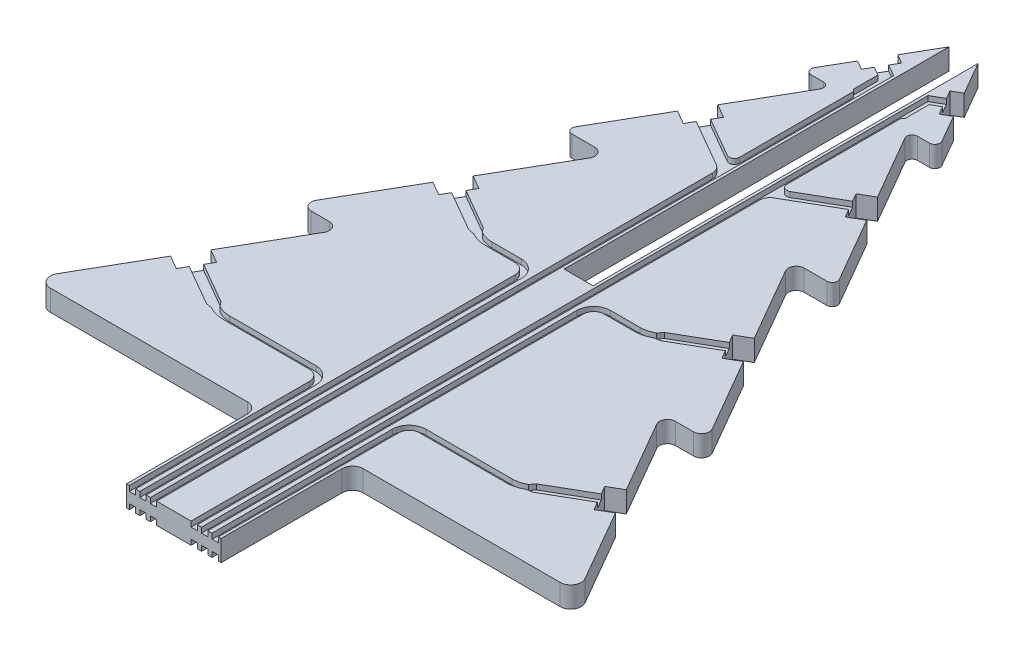
from build123d import *

# Parameters (mm, degrees)
ESBO_O1_W                       = 18
ESBO_O1_H                       = 25
RVORE_DEPTH                     = 4
FILETE2_R                       = 1
FILETE3_R                       = 1
FILETE4_R                       = 1
FILETE5_R                       = 1
FILETE6_R                       = 1
FILETE7_R                       = 1
FILETE8_R                       = 1.5
FILETE9_R                       = 1.5
FILETE10_R                      = 1.5
FILETE11_R                      = 1.5
FILETE12_R                      = 2
FILETE13_R                      = 2
FILETE14_R                      = 2
FILETE15_R                      = 2
FILETE16_R                      = 1.5
FILETE17_R                      = 1.5
CORTES_DO_LED_DEPTH             = 10
V_OS_DEPTH                      = 1
FILETE18_R                      = 2
FILETE19_R                      = 1
CHANFRO7_SIZE                   = 0.5
CORTE_EXTRUS_O1_START           = -1
CORTE_EXTRUS_O1_DEPTH           = 1
FILETE20_R                      = 1.5
FILETE21_R                      = 1.5
CHANFRO8_SIZE                   = 0.5
ESPELHAR_START                  = 3
ESPELHAR_V_OS_DA_FRENTE_DEPTH   = 1
ESPELHAR_V_OS_DA_TRASEIRA_DEPTH = 1
ESBO_O10_W                      = 5.5
ESBO_O10_H                      = 78
ENCAIXE_DEPTH                   = 149.882469386


# Read off the part's stored shape, not the designer's step: Espelhar Vãos da Frente, Espelhar Vãos da Traseira
with BuildPart() as part:
    # Esboço1 → rvore (new body)
    with BuildSketch(Plane(origin=(0, 0, 0), x_dir=(1, 0, 0), z_dir=(0, 1, 0))):
        with Locations((0, -127.5)):
            Rectangle(ESBO_O1_W, ESBO_O1_H)
        Polygon((-51.961524227, -115), (-9, -115), (9, -115), (51.961524227, -115), (30.310889132, -77.5), (-30.310889132, -77.5), align=None)
        Polygon((-8.660254038, -40), (-30.310889132, -77.5), (30.310889132, -77.5), (8.660254038, -40), align=None)
        Polygon((-17.320508076, -40), (-8.660254038, -40), (0, -25), (8.660254038, -40), (17.320508076, -40), (0, -10), align=None)
        Polygon((8.660254038, -40), (30.310889132, -77.5), (38.97114317, -77.5), (17.320508076, -40), align=None)
        Polygon((0, -25), (-8.660254038, -40), (8.660254038, -40), align=None)
        Polygon((-38.97114317, -77.5), (-30.310889132, -77.5), (-8.660254038, -40), (-17.320508076, -40), align=None)
        Polygon((-25.980762114, -40), (-17.320508076, -40), (0, -10), (17.320508076, -40), (25.980762114, -40), (7.216878365, -7.5), (-7.216878365, -7.5), align=None)
        Polygon((0, 5), (-7.216878365, -7.5), (7.216878365, -7.5), align=None)
        Polygon((-12.990381057, -7.5), (-7.216878365, -7.5), (0, 5), (7.216878365, -7.5), (12.990381057, -7.5), (0, 15), align=None)
    extrude(amount=RVORE_DEPTH)

    # Filete2
    filete2_edges = [part.edges().sort_by_distance(p)[0] for p in [
        (12.990381057, 2, 7.5),
    ]]
    fillet(filete2_edges, radius=FILETE2_R)

    # Filete3
    filete3_edges = [part.edges().sort_by_distance(p)[0] for p in [
        (-12.990381057, 2, 7.5),
    ]]
    fillet(filete3_edges, radius=FILETE3_R)

    # Filete4
    filete4_edges = [part.edges().sort_by_distance(p)[0] for p in [
        (-7.216878365, 2, 7.5),
    ]]
    fillet(filete4_edges, radius=FILETE4_R)

    # Filete5
    filete5_edges = [part.edges().sort_by_distance(p)[0] for p in [
        (7.216878365, 2, 7.5),
    ]]
    fillet(filete5_edges, radius=FILETE5_R)

    # Filete6
    filete6_edges = [part.edges().sort_by_distance(p)[0] for p in [
        (25.980762114, 2, 40),
    ]]
    fillet(filete6_edges, radius=FILETE6_R)

    # Filete7
    filete7_edges = [part.edges().sort_by_distance(p)[0] for p in [
        (-25.980762114, 2, 40),
    ]]
    fillet(filete7_edges, radius=FILETE7_R)

    # Filete8
    filete8_edges = [part.edges().sort_by_distance(p)[0] for p in [
        (17.320508076, 2, 40),
    ]]
    fillet(filete8_edges, radius=FILETE8_R)

    # Filete9
    filete9_edges = [part.edges().sort_by_distance(p)[0] for p in [
        (-17.320508076, 2, 40),
    ]]
    fillet(filete9_edges, radius=FILETE9_R)

    # Filete10
    filete10_edges = [part.edges().sort_by_distance(p)[0] for p in [
        (38.97114317, 2, 77.5),
    ]]
    fillet(filete10_edges, radius=FILETE10_R)

    # Filete11
    filete11_edges = [part.edges().sort_by_distance(p)[0] for p in [
        (-38.97114317, 2, 77.5),
    ]]
    fillet(filete11_edges, radius=FILETE11_R)

    # Filete12
    filete12_edges = [part.edges().sort_by_distance(p)[0] for p in [
        (51.961524227, 2, 115),
    ]]
    fillet(filete12_edges, radius=FILETE12_R)

    # Filete13
    filete13_edges = [part.edges().sort_by_distance(p)[0] for p in [
        (-51.961524227, 2, 115),
    ]]
    fillet(filete13_edges, radius=FILETE13_R)

    # Filete14
    filete14_edges = [part.edges().sort_by_distance(p)[0] for p in [
        (9, 2, 115),
    ]]
    fillet(filete14_edges, radius=FILETE14_R)

    # Filete15
    filete15_edges = [part.edges().sort_by_distance(p)[0] for p in [
        (-9, 2, 115),
    ]]
    fillet(filete15_edges, radius=FILETE15_R)

    # Filete16
    filete16_edges = [part.edges().sort_by_distance(p)[0] for p in [
        (30.310889132, 2, 77.5),
    ]]
    fillet(filete16_edges, radius=FILETE16_R)

    # Filete17
    filete17_edges = [part.edges().sort_by_distance(p)[0] for p in [
        (-30.310889132, 2, 77.5),
    ]]
    fillet(filete17_edges, radius=FILETE17_R)

    # Esboço5 → Cortes do Led (cut)
    with BuildSketch(Plane(origin=(0, 4, 0), x_dir=(1, 0, 0), z_dir=(0, 1, 0))):
        Polygon((42.319473419, -98.299478112), (39.519473419, -93.449735851), (36.921397208, -94.949735851), (39.721397208, -99.799478112), align=None)
        Polygon((29.544605065, -61.172757061), (26.744605065, -56.3230148), (24.146528853, -57.8230148), (26.946528853, -62.672757061), align=None)
        Polygon((17.99973671, -26.176458504), (15.19973671, -21.326716243), (12.601660498, -22.826716243), (15.401660498, -27.676458504), align=None)
        Polygon((9.124355653, -0.803847577), (6.324355653, 4.045894684), (4.592304845, 3.045894684), (7.392304845, -1.803847577), align=None)
        Polygon((-9.124355653, -0.803847577), (-6.324355653, 4.045894684), (-4.592304845, 3.045894684), (-7.392304845, -1.803847577), align=None)
        Polygon((-17.99973671, -26.176458504), (-15.19973671, -21.326716243), (-12.601660498, -22.826716243), (-15.401660498, -27.676458504), align=None)
        Polygon((-29.544605065, -61.172757061), (-26.744605065, -56.3230148), (-24.146528853, -57.8230148), (-26.946528853, -62.672757061), align=None)
        Polygon((-42.319473419, -98.299478112), (-39.519473419, -93.449735851), (-36.921397208, -94.949735851), (-39.721397208, -99.799478112), align=None)
    extrude(amount=-CORTES_DO_LED_DEPTH, mode=Mode.SUBTRACT)

    # Esboço6 → Vãos (cut)
    with BuildSketch(Plane(origin=(0, 4, 0), x_dir=(1, 0, 0), z_dir=(0, 1, 0))):
        Polygon((3.275, -140), (4.475, -140), (4.475, -31.906507915), (14.501660498, -26.117612777), (13.501660498, -24.38556197), (4.475, -29.597106838), (4.475, -5.716873023), (4.875, -5.716873023), (4.875, -1.178753238), (6.492304845, -0.24500185), (5.492304845, 1.487048957), (3.275, 0.206887408), align=None)
        with BuildLine():
            Line((5.275, -68.59814367), (5.275, -140))
            Line((5.275, -140), (6.475, -140))
            Line((6.475, -140), (6.475, -68.59814367))
            ThreePointArc((6.475, -68.59814367), (7.060786438, -67.183930107), (8.475, -66.59814367))
            Line((8.475, -66.59814367), (14.086274815, -66.59814367))
            ThreePointArc((14.086274815, -66.59814367), (15.690952895, -66.386883793), (17.186274815, -65.767501173))
            Line((17.186274815, -65.767501173), (18.252300219, -65.613911335))
            Line((18.252300219, -65.613911335), (26.046528853, -61.113911335))
            Line((26.046528853, -61.113911335), (25.046528853, -59.381860527))
            Line((25.046528853, -59.381860527), (17.252300219, -63.881860527))
            Line((17.252300219, -63.881860527), (16.586274815, -64.728270689))
            ThreePointArc((16.586274815, -64.728270689), (15.380370041, -65.227772801), (14.086274815, -65.39814367))
            Line((14.086274815, -65.39814367), (8.475, -65.39814367))
            ThreePointArc((8.475, -65.39814367), (6.2122583, -66.33540197), (5.275, -68.59814367))
        make_face()
        with BuildLine():
            Line((7.275, -105.724864812), (7.275, -140))
            Line((7.275, -140), (8.475000015, -140))
            Line((8.475000015, -140), (8.475000015, -105.724864812))
            ThreePointArc((8.475000015, -105.724864812), (9.060786384, -104.310651231), (10.47499994, -103.724864804))
            Line((10.47499994, -103.724864804), (26.861143115, -103.724864804))
            ThreePointArc((26.861143115, -103.724864804), (28.465821237, -103.513604922), (29.96114317, -102.894222224))
            Line((29.96114317, -102.894222224), (31.027168574, -102.740632385))
            Line((31.027168574, -102.740632385), (38.821397208, -98.240632385))
            Line((38.821397208, -98.240632385), (37.821397208, -96.508581578))
            Line((37.821397208, -96.508581578), (30.027168574, -101.008581578))
            Line((30.027168574, -101.008581578), (29.36114317, -101.854991739))
            ThreePointArc((29.36114317, -101.854991739), (28.155238386, -102.354493946), (26.861143115, -102.52486482))
            Line((26.861143115, -102.52486482), (10.47499994, -102.52486482))
            ThreePointArc((10.47499994, -102.52486482), (8.212258253, -103.46212311), (7.275, -105.724864812))
        make_face()
    extrude(amount=-V_OS_DEPTH, mode=Mode.SUBTRACT)

    # Filete18
    filete18_edges = [part.edges().sort_by_distance(p)[0] for p in [
        (4.475, 3.5, 31.906507915),
    ]]
    fillet(filete18_edges, radius=FILETE18_R)

    # Filete19
    filete19_edges = [part.edges().sort_by_distance(p)[0] for p in [
        (4.475, 3.5, 29.597106838),
    ]]
    fillet(filete19_edges, radius=FILETE19_R)

    # Chanfro7
    # the kernel refuses this chamfer: 0.5 mm, written as the material it takes off along each edge
    with BuildSketch(Plane(origin=(4.475, 5.285841494, 5.716873023), x_dir=(-0.027495876610585647, 0, 0.9996219169112968), z_dir=(0, -1, 0))) as chanfro7_piece_1_section:
        Polygon((CHANFRO7_SIZE * 0.999621916911, -CHANFRO7_SIZE * 0.0274958766106), (-CHANFRO7_SIZE * 0.0274958766106, -CHANFRO7_SIZE * 0.999621916911), (0, 0), align=None)
    chanfro7_piece_1 = extrude(amount=2.285841494, mode=Mode.PRIVATE)
    chanfro7_piece_1 = split(chanfro7_piece_1, bisect_by=Plane(origin=(4.875, 3.5, 5.889095245), z_dir=(-1, 0, 0)), keep=Keep.TOP, mode=Mode.PRIVATE)
    add(chanfro7_piece_1, mode=Mode.SUBTRACT)

    # Esboço7 → Corte-extrusão1 (cut)
    with BuildSketch(Plane.XZ.offset(CORTE_EXTRUS_O1_START)):
        Polygon((4.875, 1.178753238), (4.875, 5.716873023), (4.475, 5.716873023), (4.475, 140), (3.275, 140), (3.275, -0.206887408), (5.492304845, -1.487048957), (6.492304845, 0.24500185), align=None)
        with BuildLine():
            Line((6.475, 140), (5.275, 140))
            Line((5.275, 140), (5.275, 30.867277431))
            ThreePointArc((5.275, 30.867277431), (5.569744112, 29.767277431), (6.375, 28.962021542))
            Line((6.375, 28.962021542), (6.573457268, 28.38556197))
            Line((6.573457268, 28.38556197), (13.501660498, 24.38556197))
            Line((13.501660498, 24.38556197), (14.501660498, 26.117612777))
            Line((14.501660498, 26.117612777), (7.573457268, 30.117612777))
            Line((7.573457268, 30.117612777), (6.975, 30.001252027))
            ThreePointArc((6.975, 30.001252027), (6.608974596, 30.367277431), (6.475, 30.867277431))
            Line((6.475, 30.867277431), (6.475, 140))
        make_face()
        with BuildLine():
            Line((8.475, 140), (7.275, 140))
            Line((7.275, 140), (7.275, 68.59814367))
            ThreePointArc((7.275, 68.59814367), (8.193190015, 66.354632316), (10.420839495, 65.39860204))
            ThreePointArc((10.420839495, 65.39860204), (10.447866811, 65.418301754), (10.475, 65.437855388))
            Line((10.475, 65.437855388), (10.475, 65.39814367))
            Line((10.475, 65.39814367), (14.086274815, 65.39814367))
            ThreePointArc((14.086274815, 65.39814367), (15.380370041, 65.227772801), (16.586274815, 64.728270689))
            Line((16.586274815, 64.728270689), (17.252300219, 63.881860527))
            Line((17.252300219, 63.881860527), (25.046528853, 59.381860527))
            Line((25.046528853, 59.381860527), (26.046528853, 61.113911335))
            Line((26.046528853, 61.113911335), (18.252300219, 65.613911335))
            Line((18.252300219, 65.613911335), (17.186274815, 65.767501173))
            ThreePointArc((17.186274815, 65.767501173), (15.690952895, 66.386883793), (14.086274815, 66.59814367))
            Line((14.086274815, 66.59814367), (10.475, 66.59814367))
            ThreePointArc((10.475, 66.59814367), (9.060786438, 67.183930107), (8.475, 68.59814367))
            Line((8.475, 68.59814367), (8.475, 102.52486472))
            Line((8.475, 102.52486472), (26.86114317, 102.52486472))
            ThreePointArc((26.86114317, 102.52486472), (28.155238396, 102.354493852), (29.36114317, 101.854991739))
            Line((29.36114317, 101.854991739), (30.027168574, 101.008581578))
            Line((30.027168574, 101.008581578), (37.821397208, 96.508581578))
            Line((37.821397208, 96.508581578), (38.821397208, 98.240632385))
            Line((38.821397208, 98.240632385), (31.027168574, 102.740632385))
            Line((31.027168574, 102.740632385), (29.96114317, 102.894222224))
            ThreePointArc((29.96114317, 102.894222224), (28.46582125, 103.513604843), (26.86114317, 103.72486472))
            Line((26.86114317, 103.72486472), (8.475, 103.72486472))
            Line((8.475, 103.72486472), (8.475, 140))
        make_face()
    extrude(amount=CORTE_EXTRUS_O1_DEPTH, mode=Mode.SUBTRACT)

    # Filete20
    filete20_edges = [part.edges().sort_by_distance(p)[0] for p in [
        (8.475, 0.5, 102.52486472),
    ]]
    fillet(filete20_edges, radius=FILETE20_R)

    # Filete21
    filete21_edges = [part.edges().sort_by_distance(p)[0] for p in [
        (8.475, 0.5, 103.72486472),
    ]]
    fillet(filete21_edges, radius=FILETE21_R)

    # Chanfro8
    # the kernel refuses this chamfer: 0.5 mm, written as the material it takes off along each edge
    with BuildSketch(Plane(origin=(4.475, 1, 5.716873023), x_dir=(-0.027495876610585647, 0, 0.9996219169112968), z_dir=(0, -1, 0))) as chanfro8_piece_1_section:
        Polygon((CHANFRO8_SIZE * 0.999621916911, -CHANFRO8_SIZE * 0.0274958766106), (-CHANFRO8_SIZE * 0.0274958766106, -CHANFRO8_SIZE * 0.999621916911), (0, 0), align=None)
    chanfro8_piece_1 = extrude(amount=2.285841494, mode=Mode.PRIVATE)
    chanfro8_piece_1 = split(chanfro8_piece_1, bisect_by=Plane(origin=(4.875, 0.5, 5.889095245), z_dir=(-1, 0, 0)), keep=Keep.TOP, mode=Mode.PRIVATE)
    add(chanfro8_piece_1, mode=Mode.SUBTRACT)

    # Espelhar Vãos da Frente outline → Espelhar Vãos da Frente (cut)
    with BuildSketch(Plane(origin=(0, 0, 0), x_dir=(1, 0, 0), z_dir=(0, 1, 0)).offset(ESPELHAR_START)):
        with BuildLine():
            Line((-4.475, -6.216873023), (-4.475, -27.865056031))
            ThreePointArc((-4.475, -27.865056031), (-4.975, -28.731081435), (-5.975, -28.731081435))
            Line((-5.975, -28.731081435), (-13.501660498, -24.38556197))
            Line((-13.501660498, -24.38556197), (-14.501660498, -26.117612777))
            Line((-14.501660498, -26.117612777), (-5.475, -31.329157646))
            ThreePointArc((-5.475, -31.329157646), (-4.742949192, -32.061208454), (-4.475, -33.061208454))
            Line((-4.475, -33.061208454), (-4.475, -140))
            Line((-4.475, -140), (-3.275, -140))
            Line((-3.275, -140), (-3.275, 0.206887408))
            Line((-3.275, 0.206887408), (-5.492304845, 1.487048957))
            Line((-5.492304845, 1.487048957), (-6.492304845, -0.24500185))
            Line((-6.492304845, -0.24500185), (-4.875, -1.178753238))
            Line((-4.875, -1.178753238), (-4.875, -5.816873023))
            Line((-4.875, -5.816873023), (-4.475, -6.216873023))
        make_face()
        with BuildLine():
            Line((-8.475000015, -140), (-7.275, -140))
            Line((-7.275, -140), (-7.274999974, -105.724864812))
            ThreePointArc((-7.274999974, -105.724864812), (-8.212258264, -103.462123136), (-10.47499994, -102.524864846))
            Line((-10.47499994, -102.524864846), (-26.861143115, -102.524864778))
            ThreePointArc((-26.861143115, -102.524864778), (-28.15523838, -102.354493904), (-29.361143191, -101.854991776))
            Line((-29.361143191, -101.854991776), (-30.027168574, -101.008581578))
            Line((-30.027168574, -101.008581578), (-37.821397208, -96.508581578))
            Line((-37.821397208, -96.508581578), (-38.821397208, -98.240632385))
            Line((-38.821397208, -98.240632385), (-31.027168574, -102.740632385))
            Line((-31.027168574, -102.740632385), (-29.961143187, -102.894222253))
            ThreePointArc((-29.961143187, -102.894222253), (-28.465821232, -103.513604887), (-26.861143115, -103.724864769))
            Line((-26.861143115, -103.724864769), (-10.47499994, -103.724864845))
            ThreePointArc((-10.47499994, -103.724864845), (-9.060786401, -104.310651273), (-8.474999973, -105.724864812))
            Line((-8.474999973, -105.724864812), (-8.475000015, -140))
        make_face()
        with BuildLine():
            Line((-6.475, -140), (-5.275, -140))
            Line((-5.275, -140), (-5.275, -68.59814367))
            ThreePointArc((-5.275, -68.59814367), (-6.2122583, -66.33540197), (-8.475, -65.39814367))
            Line((-8.475, -65.39814367), (-14.086274815, -65.39814367))
            ThreePointArc((-14.086274815, -65.39814367), (-15.38037004, -65.227772801), (-16.586274815, -64.728270689))
            Line((-16.586274815, -64.728270689), (-17.252300219, -63.881860527))
            Line((-17.252300219, -63.881860527), (-25.046528853, -59.381860527))
            Line((-25.046528853, -59.381860527), (-26.046528853, -61.113911335))
            Line((-26.046528853, -61.113911335), (-18.252300219, -65.613911335))
            Line((-18.252300219, -65.613911335), (-17.186274815, -65.767501173))
            ThreePointArc((-17.186274815, -65.767501173), (-15.690952895, -66.386883793), (-14.086274815, -66.59814367))
            Line((-14.086274815, -66.59814367), (-8.475, -66.59814367))
            ThreePointArc((-8.475, -66.59814367), (-7.060786437, -67.183930108), (-6.475, -68.59814367))
            Line((-6.475, -68.59814367), (-6.475, -140))
        make_face()
    extrude(amount=ESPELHAR_V_OS_DA_FRENTE_DEPTH, mode=Mode.SUBTRACT)

    # Espelhar Vãos da Traseira outline → Espelhar Vãos da Traseira (cut)
    with BuildSketch(Plane(origin=(0, 0, 0), x_dir=(1, 0, 0), z_dir=(0, 1, 0))):
        with BuildLine():
            Line((-26.86114317, -103.72486472), (-9.975, -103.72486472))
            ThreePointArc((-9.975, -103.72486472), (-8.914339829, -104.164204549), (-8.475, -105.22486472))
            Line((-8.475, -105.22486472), (-8.475, -140))
            Line((-8.475, -140), (-7.275, -140))
            Line((-7.275, -140), (-7.275, -68.59814367))
            ThreePointArc((-7.275, -68.59814367), (-8.193190015, -66.354632316), (-10.420839495, -65.39860204))
            ThreePointArc((-10.420839495, -65.39860204), (-10.447866811, -65.418301754), (-10.475, -65.437855388))
            Line((-10.475, -65.437855388), (-10.475, -65.39814367))
            Line((-10.475, -65.39814367), (-14.086274815, -65.39814367))
            ThreePointArc((-14.086274815, -65.39814367), (-15.38037004, -65.227772801), (-16.586274815, -64.728270689))
            Line((-16.586274815, -64.728270689), (-17.252300219, -63.881860527))
            Line((-17.252300219, -63.881860527), (-25.046528853, -59.381860527))
            Line((-25.046528853, -59.381860527), (-26.046528853, -61.113911335))
            Line((-26.046528853, -61.113911335), (-18.252300219, -65.613911335))
            Line((-18.252300219, -65.613911335), (-17.186274815, -65.767501173))
            ThreePointArc((-17.186274815, -65.767501173), (-15.690952895, -66.386883793), (-14.086274815, -66.59814367))
            Line((-14.086274815, -66.59814367), (-10.475, -66.59814367))
            ThreePointArc((-10.475, -66.59814367), (-9.060786437, -67.183930107), (-8.475, -68.59814367))
            Line((-8.475, -68.59814367), (-8.475, -101.02486472))
            ThreePointArc((-8.475, -101.02486472), (-8.914339828, -102.085524892), (-9.975, -102.52486472))
            Line((-9.975, -102.52486472), (-26.86114317, -102.52486472))
            ThreePointArc((-26.86114317, -102.52486472), (-28.155238396, -102.354493852), (-29.36114317, -101.854991739))
            Line((-29.36114317, -101.854991739), (-30.027168574, -101.008581578))
            Line((-30.027168574, -101.008581578), (-37.821397208, -96.508581578))
            Line((-37.821397208, -96.508581578), (-38.821397208, -98.240632385))
            Line((-38.821397208, -98.240632385), (-31.027168574, -102.740632385))
            Line((-31.027168574, -102.740632385), (-29.96114317, -102.894222224))
            ThreePointArc((-29.96114317, -102.894222224), (-28.46582125, -103.513604843), (-26.86114317, -103.72486472))
        make_face()
        Polygon((-4.475, -6.216873023), (-4.475, -140), (-3.275, -140), (-3.275, 0.206887408), (-5.492304845, 1.487048957), (-6.492304845, -0.24500185), (-4.875, -1.178753238), (-4.875, -5.816873023), align=None)
        with BuildLine():
            Line((-6.475, -30.867277431), (-6.475, -140))
            Line((-6.475, -140), (-5.275, -140))
            Line((-5.275, -140), (-5.275, -30.867277431))
            ThreePointArc((-5.275, -30.867277431), (-5.569744112, -29.767277431), (-6.375, -28.962021542))
            Line((-6.375, -28.962021542), (-6.573457268, -28.38556197))
            Line((-6.573457268, -28.38556197), (-13.501660498, -24.38556197))
            Line((-13.501660498, -24.38556197), (-14.501660498, -26.117612777))
            Line((-14.501660498, -26.117612777), (-7.573457268, -30.117612777))
            Line((-7.573457268, -30.117612777), (-6.975, -30.001252027))
            ThreePointArc((-6.975, -30.001252027), (-6.608974596, -30.367277431), (-6.475, -30.867277431))
        make_face()
    extrude(amount=ESPELHAR_V_OS_DA_TRASEIRA_DEPTH, mode=Mode.SUBTRACT)

    # Esboço10 → Encaixe (cut, through all)
    with BuildSketch(Plane(origin=(0, 4, 0), x_dir=(1, 0, 0), z_dir=(0, 1, 0))):
        with Locations((0, -24)):
            Rectangle(ESBO_O10_W, ESBO_O10_H)
    extrude(amount=-ENCAIXE_DEPTH, mode=Mode.SUBTRACT)


solid = part.part
